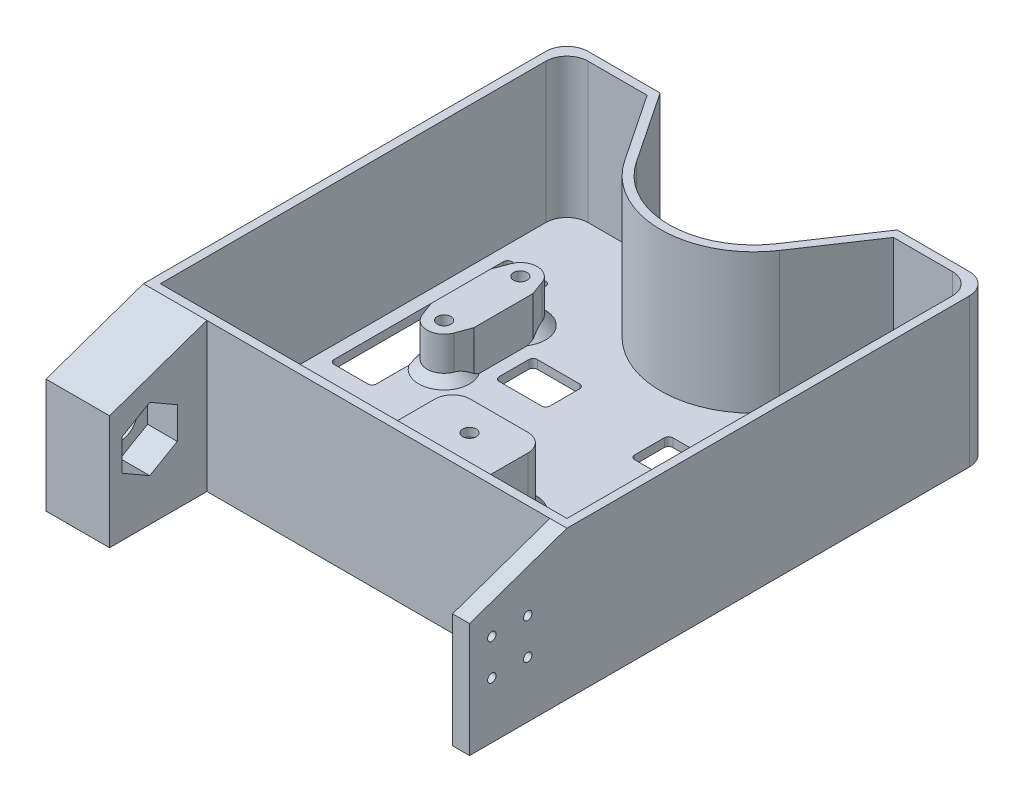
from build123d import *

# Parameters (mm, degrees)
AUFSATZ_LINEAR_AUSTRAGEN1_DEPTH  = 35
WANDUNG1_T                       = -2
SKIZZE1_W                        = 10
SKIZZE1_H                        = 42
SCHNITT_LINEAR_AUSTRAGEN1_DEPTH  = 2
SKIZZE2_R                        = 1.6
AUFSATZ_LINEAR_AUSTRAGEN2_DEPTH  = 10
VERRUNDUNG1_R                    = 1
SKIZZE6_R                        = 1.6
SCHNITT_LINEAR_AUSTRAGEN2_DEPTH  = 75.35724578
SCHNITT_LINEAR_AUSTRAGEN3_DEPTH  = 9
FASE1_SIZE                       = 2
SKIZZE8_W                        = 12
SKIZZE8_H                        = 9
SCHNITT_LINEAR_AUSTRAGEN4_DEPTH  = 2
VERRUNDUNG2_R                    = 1
VERRUNDUNG3_R                    = 5
VERRUNDUNG4_R                    = 5
SCHNITT_LINEAR_AUSTRAGEN5_REACH  = 80.899
AUFSATZ_LINEAR_AUSTRAGEN3_DEPTH  = 12
AUFSATZ_LINEAR_AUSTRAGEN4_DEPTH  = 2
FASE2_SIZE                       = 2
SKIZZE13_R                       = 1.6
SCHNITT_LINEAR_AUSTRAGEN6_DEPTH  = 2
SKIZZE14_W                       = 15
SKIZZE14_H                       = 35
SKIZZE14_W_2                     = 4
AUFSATZ_LINEAR_AUSTRAGEN5_DEPTH  = 23
SKIZZE18_R                       = 1
SCHNITT_LINEAR_AUSTRAGEN8_DEPTH  = 4
SKIZZE19_R                       = 2.5
SCHNITT_LINEAR_AUSTRAGEN9_DEPTH  = 2.5
SKIZZE20_W                       = 5
SKIZZE20_H                       = 10
SCHNITT_LINEAR_AUSTRAGEN10_DEPTH = 2
SKIZZE21_R                       = 4
SCHNITT_LINEAR_AUSTRAGEN11_DEPTH = 15
SKIZZE23_R                       = 7.5
SCHNITT_LINEAR_AUSTRAGEN12_DEPTH = 1
SKIZZE24_R                       = 7.5
SCHNITT_LINEAR_AUSTRAGEN13_DEPTH = 4
SCHNITT_LINEAR_AUSTRAGEN13_DRAFT = -45
SCHNITT_LINEAR_AUSTRAGEN14_DEPTH = 7
SCHNITT_LINEAR_AUSTRAGEN15_REACH = 130.662


# Some blends are built 0.0001 mm under size
with BuildPart() as part:
    # Grundplatte → Aufsatz-Linear austragen1 (new body)
    with BuildSketch(Plane(origin=(0, 0, 0), x_dir=(1, 0, 0), z_dir=(0, 1, 0))):
        with BuildLine():
            Line((-50, 50), (-50, -50))
            Line((-50, -50), (50, -50))
            Line((50, -50), (50, 50))
            Line((50, 50), (28, 50))
            Line((28, 50), (16.61985221, 33))
            ThreePointArc((16.61985221, 33), (0, 24.125669082), (-16.61985221, 33))
            Line((-16.61985221, 33), (-28, 50))
            Line((-28, 50), (-50, 50))
        make_face()
    extrude(amount=AUFSATZ_LINEAR_AUSTRAGEN1_DEPTH)

    # Wandung1
    wandung1_openings = [part.faces().sort_by_distance(p)[0] for p in [
        (0, 35, 4.219695438),
    ]]
    offset(amount=WANDUNG1_T, openings=wandung1_openings, kind=Kind.INTERSECTION)

    # Skizze1 → Schnitt-Linear austragen1 (cut)
    with BuildSketch(Plane(origin=(0, 2, 0), x_dir=(1, 0, 0), z_dir=(0, 1, 0))):
        with Locations((-40, 10)):
            Rectangle(SKIZZE1_W, SKIZZE1_H)
        with Locations((40, 10)):
            Rectangle(SKIZZE1_W, SKIZZE1_H)
    extrude(amount=-SCHNITT_LINEAR_AUSTRAGEN1_DEPTH, mode=Mode.SUBTRACT)

    # Skizze2 → Aufsatz-Linear austragen2 (add)
    # profile 1 of 2: a face of its own
    with BuildSketch(Plane(origin=(0, 2, 0), x_dir=(1, 0, 0), z_dir=(0, 1, 0))):
        with BuildLine():
            Line((-35, 16), (-35, 4))
            Line((-35, 4), (-35, 3))
            Line((-35, 3), (-33.753255524, -0.383138811))
            ThreePointArc((-33.753255524, -0.383138811), (-30, -3), (-26.246744476, -0.383138811))
            Line((-26.246744476, -0.383138811), (-25, 3))
            Line((-25, 3), (-25, 4))
            Line((-25, 4), (-25, 16))
            Line((-25, 16), (-25, 17))
            Line((-25, 17), (-26.246744476, 20.383138811))
            ThreePointArc((-26.246744476, 20.383138811), (-30, 23), (-33.753255524, 20.383138811))
            Line((-33.753255524, 20.383138811), (-35, 17))
            Line((-35, 17), (-35, 16))
        make_face()
        with Locations(Location((-30, 19, 0), (0, 0, 270))):
            Circle(SKIZZE2_R, mode=Mode.SUBTRACT)
        with Locations(Location((-30, 1, 0), (0, 0, 270))):
            Circle(SKIZZE2_R, mode=Mode.SUBTRACT)
    # profile 2 of 2: a face of its own
    with BuildSketch(Plane(origin=(0, 2, 0), x_dir=(1, 0, 0), z_dir=(0, 1, 0))):
        with BuildLine():
            Line((35, 16), (35, 17))
            Line((35, 17), (33.753255524, 20.383138811))
            ThreePointArc((33.753255524, 20.383138811), (30, 23), (26.246744476, 20.383138811))
            Line((26.246744476, 20.383138811), (25, 17))
            Line((25, 17), (25, 16))
            Line((25, 16), (25, 4))
            Line((25, 4), (25, 3))
            Line((25, 3), (26.246744476, -0.383138811))
            ThreePointArc((26.246744476, -0.383138811), (30, -3), (33.753255524, -0.383138811))
            Line((33.753255524, -0.383138811), (35, 3))
            Line((35, 3), (35, 4))
            Line((35, 4), (35, 16))
        make_face()
        with Locations(Location((30, 1, 0), (0, 0, 90))):
            Circle(SKIZZE2_R, mode=Mode.SUBTRACT)
        with Locations(Location((30, 19, 0), (0, 0, 90))):
            Circle(SKIZZE2_R, mode=Mode.SUBTRACT)
    extrude(amount=AUFSATZ_LINEAR_AUSTRAGEN2_DEPTH)

    # Verrundung1
    verrundung1_edges = [part.edges().sort_by_distance(p)[0] for p in [
        (-35, 1, -31),
        (-35, 1, 11),
        (-45, 1, 11),
        (-45, 1, -31),
        (45, 1, -31),
        (45, 1, 11),
        (35, 1, 11),
        (35, 1, -31),
    ]]
    fillet(verrundung1_edges, radius=VERRUNDUNG1_R)

    # Skizze6 → Schnitt-Linear austragen2 (cut, through all)
    with BuildSketch(Plane(origin=(0, 12, 0), x_dir=(1, 0, 0), z_dir=(0, 1, 0))):
        with Locations(Location((-30, 19, 0), (0, 0, 270))):
            Circle(SKIZZE6_R)
        with Locations(Location((-30, 1, 0), (0, 0, 270))):
            Circle(SKIZZE6_R)
        with Locations(Location((30, 19, 0), (0, 0, 90))):
            Circle(SKIZZE6_R)
        with Locations(Location((30, 1, 0), (0, 0, 90))):
            Circle(SKIZZE6_R)
    extrude(amount=-SCHNITT_LINEAR_AUSTRAGEN2_DEPTH, mode=Mode.SUBTRACT)

    # Skizze7 → Schnitt-Linear austragen3 (cut)
    with BuildSketch(Plane.XZ):
        Polygon((-26.709103466, -1), (-28.354551733, 1.85), (-31.645448267, 1.85), (-33.290896534, -1), (-31.645448267, -3.85), (-28.354551733, -3.85), align=None)
        Polygon((28.354551733, -21.85), (26.709103466, -19), (28.354551733, -16.15), (31.645448267, -16.15), (33.290896534, -19), (31.645448267, -21.85), align=None)
        Polygon((-26.709103466, -19), (-28.354551733, -16.15), (-31.645448267, -16.15), (-33.290896534, -19), (-31.645448267, -21.85), (-28.354551733, -21.85), align=None)
        Polygon((28.354551733, -3.85), (26.709103466, -1), (28.354551733, 1.85), (31.645448267, 1.85), (33.290896534, -1), (31.645448267, -3.85), align=None)
    extrude(amount=-SCHNITT_LINEAR_AUSTRAGEN3_DEPTH, mode=Mode.SUBTRACT)

    # Fase1
    # the kernel refuses this chamfer: 2 mm, written as the material it adds along each edge
    with BuildSketch(Plane(origin=(33.753255524, 2, 0.383138811), x_dir=(0.9379591204561566, -0.02749587661058633, 0.3456539673177909), z_dir=(0.3457847026662013, 0, -0.9383138810664834))) as fase1_piece_1_section:
        Polygon((FASE1_SIZE * 0.999621916911, -FASE1_SIZE * 0.0274958766106), (-FASE1_SIZE * 0.0274958766106, -FASE1_SIZE * 0.999621916911), (0, 0), align=None)
    fase1_piece_1 = extrude(amount=8.748917251, mode=Mode.PRIVATE)
    fase1_piece_1 = split(fase1_piece_1, bisect_by=Plane(origin=(35, 2.810043693, -0.69339811), z_dir=(-1, 0, 0)), keep=Keep.TOP, mode=Mode.PRIVATE)
    add(fase1_piece_1)
    with BuildSketch(Plane(origin=(30, 2, -1), x_dir=(-0.5946157089023157, 0, -0.8040100488965276), z_dir=(0.8040100488965276, 0, -0.5946157089023157))) as fase1_piece_2_section:
        Polygon((4 + FASE1_SIZE, 0), (4, FASE1_SIZE), (4, 0), align=None)
    fase1_piece_2 = revolve(axis=Axis((30, 2, -1), (0, 1, 0)), revolution_arc=213.285054007, mode=Mode.PRIVATE)
    fase1_piece_2 = split(fase1_piece_2, bisect_by=Plane(origin=(35, 2.618842305, 0.921149391), z_dir=(-1, 0, 0)), keep=Keep.TOP, mode=Mode.PRIVATE)
    add(fase1_piece_2)
    with BuildSketch(Plane(origin=(36.778497275, 2, -12.173908309), x_dir=(0.937959120456157, -0.027495876610586348, -0.34565396731779), z_dir=(-0.34578470266620037, 0, -0.9383138810664838))) as fase1_piece_3_section:
        Polygon((FASE1_SIZE * 0.999621916911, -FASE1_SIZE * 0.0274958766106), (-FASE1_SIZE * 0.0274958766106, -FASE1_SIZE * 0.999621916911), (0, 0), align=None)
    fase1_piece_3 = extrude(amount=8.748917251, mode=Mode.PRIVATE)
    fase1_piece_3 = split(fase1_piece_3, bisect_by=Plane(origin=(35, 2.810043693, -19.30660189), z_dir=(-1, 0, 0)), keep=Keep.TOP, mode=Mode.PRIVATE)
    add(fase1_piece_3)
    with BuildSketch(Plane(origin=(30, 2, -19), x_dir=(0.9383138810664835, 0, -0.3457847026662016), z_dir=(0.3457847026662016, 0, 0.9383138810664835))) as fase1_piece_4_section:
        Polygon((4 + FASE1_SIZE, 0), (4, FASE1_SIZE), (4, 0), align=None)
    fase1_piece_4 = revolve(axis=Axis((30, 2, -19), (0, 1, 0)), revolution_arc=213.285054007, mode=Mode.PRIVATE)
    fase1_piece_4 = split(fase1_piece_4, bisect_by=Plane(origin=(35, 2.568302244, -21.912371656), z_dir=(-1, 0, 0)), keep=Keep.TOP, mode=Mode.PRIVATE)
    add(fase1_piece_4)
    with BuildSketch(Plane(origin=(-33.753255524, 2, -20.383138811), x_dir=(-0.9379591204561563, -0.02749587661058632, -0.34565396731779174), z_dir=(-0.34578470266620215, 0, 0.9383138810664832))) as fase1_piece_5_section:
        Polygon((FASE1_SIZE * 0.999621916911, -FASE1_SIZE * 0.0274958766106), (-FASE1_SIZE * 0.0274958766106, -FASE1_SIZE * 0.999621916911), (0, 0), align=None)
    fase1_piece_5 = extrude(amount=8.748917251, mode=Mode.PRIVATE)
    fase1_piece_5 = split(fase1_piece_5, bisect_by=Plane(origin=(-35, 2.810043693, -19.30660189), z_dir=(1, 0, 0)), keep=Keep.TOP, mode=Mode.PRIVATE)
    add(fase1_piece_5)
    with BuildSketch(Plane(origin=(-30, 2, -19), x_dir=(0.5946157089023089, 0, 0.8040100488965327), z_dir=(-0.8040100488965327, 0, 0.5946157089023089))) as fase1_piece_6_section:
        Polygon((4 + FASE1_SIZE, 0), (4, FASE1_SIZE), (4, 0), align=None)
    fase1_piece_6 = revolve(axis=Axis((-30, 2, -19), (0, 1, 0)), revolution_arc=213.285054007, mode=Mode.PRIVATE)
    fase1_piece_6 = split(fase1_piece_6, bisect_by=Plane(origin=(-35, 2.618842305, -20.921149391), z_dir=(1, 0, 0)), keep=Keep.TOP, mode=Mode.PRIVATE)
    add(fase1_piece_6)
    with BuildSketch(Plane(origin=(-36.778497275, 2, -7.826091691), x_dir=(-0.937959120456156, -0.02749587661058632, 0.3456539673177927), z_dir=(0.3457847026662031, 0, 0.9383138810664828))) as fase1_piece_7_section:
        Polygon((FASE1_SIZE * 0.999621916911, -FASE1_SIZE * 0.0274958766106), (-FASE1_SIZE * 0.0274958766106, -FASE1_SIZE * 0.999621916911), (0, 0), align=None)
    fase1_piece_7 = extrude(amount=8.748917251, mode=Mode.PRIVATE)
    fase1_piece_7 = split(fase1_piece_7, bisect_by=Plane(origin=(-35, 2.810043693, -0.69339811), z_dir=(1, 0, 0)), keep=Keep.TOP, mode=Mode.PRIVATE)
    add(fase1_piece_7)
    with BuildSketch(Plane(origin=(-30, 2, -1), x_dir=(-0.9383138810664808, 0, 0.34578470266620803), z_dir=(-0.34578470266620803, 0, -0.9383138810664808))) as fase1_piece_8_section:
        Polygon((4 + FASE1_SIZE, 0), (4, FASE1_SIZE), (4, 0), align=None)
    fase1_piece_8 = revolve(axis=Axis((-30, 2, -1), (0, 1, 0)), revolution_arc=213.285054007, mode=Mode.PRIVATE)
    fase1_piece_8 = split(fase1_piece_8, bisect_by=Plane(origin=(-35, 2.568302244, 1.912371656), z_dir=(1, 0, 0)), keep=Keep.TOP, mode=Mode.PRIVATE)
    add(fase1_piece_8)

    # Skizze8 → Schnitt-Linear austragen4 (cut)
    with BuildSketch(Plane.XZ):
        with Locations((16, -9.5)):
            Rectangle(SKIZZE8_W, SKIZZE8_H)
        with Locations((-16, -9.5)):
            Rectangle(SKIZZE8_W, SKIZZE8_H)
    extrude(amount=-SCHNITT_LINEAR_AUSTRAGEN4_DEPTH, mode=Mode.SUBTRACT)

    # Verrundung2
    verrundung2_edges = [part.edges().sort_by_distance(p)[0] for p in [
        (-10, 1, -14),
        (-10, 1, -5),
        (-22, 1, -5),
        (-22, 1, -14),
        (10, 1, -5),
        (10, 1, -14),
        (22, 1, -14),
        (22, 1, -5),
    ]]
    fillet(verrundung2_edges, radius=VERRUNDUNG2_R)

    # Verrundung3
    verrundung3_edges = [part.edges().sort_by_distance(p)[0] for p in [
        (-50, 17.5, -50),
        (50, 17.5, -50),
    ]]
    fillet(verrundung3_edges, radius=VERRUNDUNG3_R)

    # Verrundung4
    verrundung4_edges = [part.edges().sort_by_distance(p)[0] for p in [
        (48, 18.5, -48),
        (-48, 18.5, -48),
    ]]
    fillet(verrundung4_edges, radius=VERRUNDUNG4_R)

    # Skizze9 → Schnitt-Linear austragen5 (cut, up to next)
    with BuildSketch(Plane.XZ, mode=Mode.PRIVATE) as schnitt_linear_austragen5_sk1:
        with BuildLine():
            Line((-6.8, 43), (6.8, 43))
            ThreePointArc((6.8, 43), (7.648528137, 42.648528137), (8, 41.8))
            Line((8, 41.8), (8, 20.2))
            ThreePointArc((8, 20.2), (7.648528137, 19.351471863), (6.8, 19))
            Line((6.8, 19), (-6.8, 19))
            ThreePointArc((-6.8, 19), (-7.648528137, 19.351471863), (-8, 20.2))
            Line((-8, 20.2), (-8, 41.8))
            ThreePointArc((-8, 41.8), (-7.648528137, 42.648528137), (-6.8, 43))
        make_face()
    schnitt_linear_austragen5_tool1 = extrude(schnitt_linear_austragen5_sk1.sketch, amount=-SCHNITT_LINEAR_AUSTRAGEN5_REACH, mode=Mode.PRIVATE) & part.part
    add(schnitt_linear_austragen5_tool1.solids().sort_by_distance((0, 0, 31))[0], mode=Mode.SUBTRACT)

    # Skizze11 → Aufsatz-Linear austragen3 (add)
    with BuildSketch(Plane(origin=(0, 2, 0), x_dir=(1, 0, 0), z_dir=(0, 1, 0))):
        with BuildLine():
            Line((-6.8, -46), (6.8, -46))
            ThreePointArc((6.8, -46), (9.769848481, -44.769848481), (11, -41.8))
            Line((11, -41.8), (11, -20.2))
            ThreePointArc((11, -20.2), (9.769848481, -17.230151519), (6.8, -16))
            Line((6.8, -16), (-6.8, -16))
            ThreePointArc((-6.8, -16), (-9.769848481, -17.230151519), (-11, -20.2))
            Line((-11, -20.2), (-11, -41.8))
            ThreePointArc((-11, -41.8), (-9.769848481, -44.769848481), (-6.8, -46))
        make_face()
        with BuildLine():
            Line((-8, -20.2), (-8, -41.8))
            ThreePointArc((-8, -41.8), (-7.648528137, -42.648528137), (-6.8, -43))
            Line((-6.8, -43), (6.8, -43))
            ThreePointArc((6.8, -43), (7.648528137, -42.648528137), (8, -41.8))
            Line((8, -41.8), (8, -20.2))
            ThreePointArc((8, -20.2), (7.648528137, -19.351471863), (6.8, -19))
            Line((6.8, -19), (-6.8, -19))
            ThreePointArc((-6.8, -19), (-7.648528137, -19.351471863), (-8, -20.2))
        make_face(mode=Mode.SUBTRACT)
    extrude(amount=AUFSATZ_LINEAR_AUSTRAGEN3_DEPTH)

    # Skizze12 → Aufsatz-Linear austragen4 (add)
    with BuildSketch(Plane(origin=(0, 14, 0), x_dir=(1, 0, 0), z_dir=(0, 1, 0))):
        with BuildLine():
            Line((11, -41.8), (11, -20.2))
            ThreePointArc((11, -20.2), (9.769848481, -17.230151519), (6.8, -16))
            Line((6.8, -16), (-6.8, -16))
            ThreePointArc((-6.8, -16), (-9.769848481, -17.230151519), (-11, -20.2))
            Line((-11, -20.2), (-11, -41.8))
            ThreePointArc((-11, -41.8), (-9.769848481, -44.769848481), (-6.8, -46))
            Line((-6.8, -46), (6.8, -46))
            ThreePointArc((6.8, -46), (9.769848481, -44.769848481), (11, -41.8))
        make_face()
    extrude(amount=AUFSATZ_LINEAR_AUSTRAGEN4_DEPTH)

    # Fase2
    fase2_edges = [part.edges().sort_by_distance(p)[0] for p in [
        (9.769848481, 2, 44.769848481),
        (11, 2, 31),
        (9.769848481, 2, 17.230151519),
        (0, 2, 16),
        (-9.769848481, 2, 17.230151519),
        (-11, 2, 31),
        (-9.769848481, 2, 44.769848481),
        (0, 2, 46),
    ]]
    chamfer(fase2_edges, length=FASE2_SIZE - 0.0001)  # a hair under: the kernel refuses the full size

    # Skizze13 → Schnitt-Linear austragen6 (cut)
    with BuildSketch(Plane(origin=(0, 16, 0), x_dir=(1, 0, 0), z_dir=(0, 1, 0))):
        with Locations(Location((0, -23, 0), (0, 0, 270))):
            Circle(SKIZZE13_R)
        with Locations(Location((0, -39, 0), (0, 0, 270))):
            Circle(SKIZZE13_R)
    extrude(amount=-SCHNITT_LINEAR_AUSTRAGEN6_DEPTH, mode=Mode.SUBTRACT)

    # Skizze14 → Aufsatz-Linear austragen5 (add)
    with BuildSketch(Plane.XY.offset(50)):
        with Locations((-42.5, 17.5)):
            Rectangle(SKIZZE14_W, SKIZZE14_H)
        with Locations((48, 17.5)):
            Rectangle(SKIZZE14_W_2, SKIZZE14_H)
    extrude(amount=AUFSATZ_LINEAR_AUSTRAGEN5_DEPTH)

    # Skizze18 → Schnitt-Linear austragen8 (cut)
    with BuildSketch(Plane(origin=(50, 0, 0), x_dir=(0, 0, -1), z_dir=(1, 0, 0))):
        with Locations((-59.257359313, 13.257359313)):
            Circle(SKIZZE18_R)
        with Locations((-67.742640687, 13.257359313)):
            Circle(SKIZZE18_R)
        with Locations((-67.742640687, 21.742640687)):
            Circle(SKIZZE18_R)
        with Locations((-59.257359313, 21.742640687)):
            Circle(SKIZZE18_R)
    extrude(amount=-SCHNITT_LINEAR_AUSTRAGEN8_DEPTH, mode=Mode.SUBTRACT)

    # Skizze19 → Schnitt-Linear austragen9 (cut)
    with BuildSketch(Plane.ZY.offset(-46)):
        with Locations(Location((63.5, 17.5, 0), (0, 0, 270))):
            Circle(SKIZZE19_R)
    extrude(amount=-SCHNITT_LINEAR_AUSTRAGEN9_DEPTH, mode=Mode.SUBTRACT)

    # Skizze20 → Schnitt-Linear austragen10 (cut)
    with BuildSketch(Plane.XY.offset(50)):
        with Locations((43.5, 17.5)):
            Rectangle(SKIZZE20_W, SKIZZE20_H)
    extrude(amount=-SCHNITT_LINEAR_AUSTRAGEN10_DEPTH, mode=Mode.SUBTRACT)

    # Skizze21 → Schnitt-Linear austragen11 (cut)
    with BuildSketch(Plane.ZY.offset(50)):
        with Locations((63.5, 17.5)):
            Circle(SKIZZE21_R)
    extrude(amount=-SCHNITT_LINEAR_AUSTRAGEN11_DEPTH, mode=Mode.SUBTRACT)

    # Skizze23 → Schnitt-Linear austragen12 (cut)
    with BuildSketch(Plane.ZY.offset(50)):
        with Locations((63.5, 17.5)):
            Circle(SKIZZE23_R)
    extrude(amount=-SCHNITT_LINEAR_AUSTRAGEN12_DEPTH, mode=Mode.SUBTRACT)


with BuildPart() as schnitt_linear_austragen13_tool:
    # Skizze24 → Schnitt-Linear austragen13 (with draft: the straight prism first)
    with BuildSketch(Plane.ZY.offset(49)):
        with Locations((63.5, 17.5)):
            Circle(SKIZZE24_R)
    extrude(amount=-SCHNITT_LINEAR_AUSTRAGEN13_DEPTH)
    # Schnitt-Linear austragen13: the draft: its side faces are tilted about the plane it starts from
    schnitt_linear_austragen13_sides = [schnitt_linear_austragen13_tool.faces().sort_by_distance(p)[0] for p in [
        (-47, 17.5, 56),
    ]]
    draft(schnitt_linear_austragen13_sides, Plane.ZY.offset(49), SCHNITT_LINEAR_AUSTRAGEN13_DRAFT)


with BuildPart() as part_1:
    add(part.part)

    # Schnitt-Linear austragen13: cut by schnitt_linear_austragen13_tool
    add(schnitt_linear_austragen13_tool.part, mode=Mode.SUBTRACT)

    # Skizze26 → Schnitt-Linear austragen14 (cut)
    with BuildSketch(Plane(origin=(-35, 0, 0), x_dir=(0, 0, -1), z_dir=(1, 0, 0))):
        Polygon((-57, 13.74722325), (-57, 21.25277675), (-63.5, 25.005553499), (-70, 21.25277675), (-70, 13.74722325), (-63.5, 9.994446501), align=None)
    extrude(amount=-SCHNITT_LINEAR_AUSTRAGEN14_DEPTH, mode=Mode.SUBTRACT)

    # Schnitt-Linear austragen15: up to this face of the body (flat: up to its plane)
    schnitt_linear_austragen15_end = Plane(part_1.part.faces().sort_by_distance((50, 17.5, 13.848926443))[0])
    # Skizze29 → Schnitt-Linear austragen15 (cut, up to the picked face)
    with BuildSketch(Plane.ZY.offset(50), mode=Mode.PRIVATE) as schnitt_linear_austragen15_sk1:
        Polygon((73, 35), (73, 27), (50, 35), align=None)
    schnitt_linear_austragen15_tool1 = split(extrude(schnitt_linear_austragen15_sk1.sketch, amount=-SCHNITT_LINEAR_AUSTRAGEN15_REACH, mode=Mode.PRIVATE), bisect_by=schnitt_linear_austragen15_end, keep=Keep.BOTH, mode=Mode.PRIVATE)
    add(schnitt_linear_austragen15_tool1.solids().sort_by(Axis((-50, 32.333333, 65.333333), (1, 0, 0)))[0], mode=Mode.SUBTRACT)


solid = part_1.part
